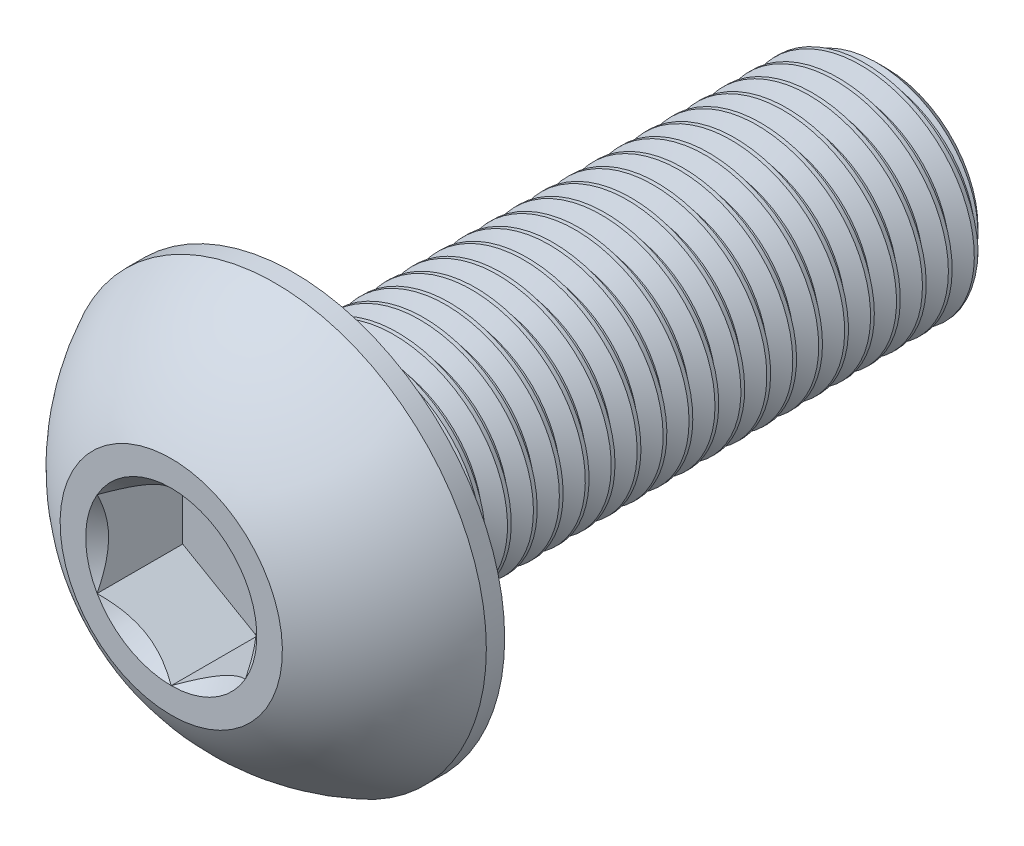
from build123d import *

# Parameters (mm, degrees)
SKETCH1_W          = 8
SKETCH1_H          = 1.5
CHAMFER1_SIZE      = 0.2625
CUT_SWEEP1_PITCH   = 0.35
CUT_EXTRUDE2_DEPTH = 1.155


with BuildPart() as part:
    # Sketch1 → Revolve1 (revolve)
    with BuildSketch(Plane(origin=(0, 0, 0), x_dir=(0, 0, -1), z_dir=(1, 0, 0))):
        with Locations((5.65, 0.75)):
            Rectangle(SKETCH1_W, SKETCH1_H)
    revolve(axis=Axis((0, 0, -9.65), (0, 0, 1)))

    # Chamfer1
    chamfer1_edges = [part.edges().sort_by_distance(p)[0] for p in [
        (0, -1.5, -9.65),
    ]]
    chamfer(chamfer1_edges, length=CHAMFER1_SIZE)

    # Cut-Sweep1: the profile of Sketch2 profile screwed along a right-hand helix of 23.857143 turns, 6 arcs to a turn; built about Z, then put on its axis
    cut_sweep1_z = Axis((0, 0, 0), (0, 0, 1))
    cut_sweep1_corners = [(1.5003, 0, 0.000173205), (1.5003, 0, -0.299423205), (1.284792687, 0, -0.175), (1.284792687, 0, -0.12425)]
    with BuildLine(mode=Mode.PRIVATE) as cut_sweep1_profile:
        Line(cut_sweep1_corners[0], cut_sweep1_corners[1])
        Line(cut_sweep1_corners[1], cut_sweep1_corners[2])
        Line(cut_sweep1_corners[2], cut_sweep1_corners[3])
        Line(cut_sweep1_corners[3], cut_sweep1_corners[0])
    cut_sweep1_cap = Face(cut_sweep1_profile.wire())
    cut_sweep1_turn_angles = [0, 30, 60, 90, 120, 150, 180, 210, 240, 270, 300, 330, 360]
    cut_sweep1_turn_weights = [1, 0.8660254037844387, 1, 0.8660254037844387, 1, 0.8660254037844387, 1, 0.8660254037844387, 1, 0.8660254037844387, 1, 0.8660254037844387, 1]
    cut_sweep1_turn_rails = [Edge.make_bspline([Vector(p[0], p[1], 0).rotate(cut_sweep1_z, cut_sweep1_turn_angles[k]) / cut_sweep1_turn_weights[k] + Vector(0, 0, p[2] + CUT_SWEEP1_PITCH * cut_sweep1_turn_angles[k] / 360) for k in range(13)], [0, 0, 0, 1, 1, 2, 2, 3, 3, 4, 4, 5, 5, 6, 6, 6], 2, cut_sweep1_turn_weights) for p in cut_sweep1_corners]
    cut_sweep1_turn_sides = [Face.make_surface_from_curves(cut_sweep1_turn_rails[p[0]], cut_sweep1_turn_rails[p[1]]) for p in [(0, 1), (1, 2), (2, 3), (3, 0)]]
    cut_sweep1_last_angles = [8280, 8310, 8340, 8370, 8400, 8430, 8460, 8490, 8520, 8550, 8580, 8584.285714286, 8588.571428571]
    cut_sweep1_last_weights = [1, 0.8660254037844387, 1, 0.8660254037844387, 1, 0.8660254037844387, 1, 0.8660254037844387, 1, 0.8660254037844387, 1, 0.9972037971811879, 1]
    cut_sweep1_last_rails = [Edge.make_bspline([Vector(p[0], p[1], 0).rotate(cut_sweep1_z, cut_sweep1_last_angles[k]) / cut_sweep1_last_weights[k] + Vector(0, 0, p[2] + CUT_SWEEP1_PITCH * cut_sweep1_last_angles[k] / 360) for k in range(13)], [0, 0, 0, 1, 1, 2, 2, 3, 3, 4, 4, 5, 5, 6, 6, 6], 2, cut_sweep1_last_weights) for p in cut_sweep1_corners]
    cut_sweep1_last_sides = [Face.make_surface_from_curves(cut_sweep1_last_rails[p[0]], cut_sweep1_last_rails[p[1]]) for p in [(0, 1), (1, 2), (2, 3), (3, 0)]]
    cut_sweep1 = Plane(origin=(0, 0, -9.65), x_dir=(0, 1, 0), z_dir=(0, 0, 1)) * Solid(Shell([*[p.moved(Location((0, 0, CUT_SWEEP1_PITCH * i))) for i in range(23) for p in cut_sweep1_turn_sides], *cut_sweep1_last_sides, cut_sweep1_cap, cut_sweep1_cap.rotate(cut_sweep1_z, 8588.571428571).moved(Location((0, 0, CUT_SWEEP1_PITCH * 8588.571428571 / 360)))]))
    add(cut_sweep1, mode=Mode.SUBTRACT)

    # Sketch7 → Revolve2 (revolve)
    with BuildSketch(Plane(origin=(0, 0, 0), x_dir=(0, 0, -1), z_dir=(1, 0, 0)), mode=Mode.PRIVATE) as revolve2_sk:
        with BuildLine():
            Line((1.4025, 2.85), (1.65, 2.85))
            Line((1.65, 2.85), (1.65, 0))
            Line((1.65, 0), (0, 0))
            Line((0, 0), (0, 1.5))
            ThreePointArc((0, 1.5), (0.59512511, 2.285251969), (1.4025, 2.85))
        make_face()
    revolve(revolve2_sk.sketch.rotate(Axis((0, 0, 0), (0, 0, -1)), 183.849419106), axis=Axis((0, 0, 0), (0, 0, -1)))

    # Sketch5 → Cut-Extrude2 (cut)
    with BuildSketch(Plane.XY):
        Polygon((1, -0.577350269), (1, 0.577350269), (0, 1.154700538), (-1, 0.577350269), (-1, -0.577350269), (0, -1.154700538), align=None)
    extrude(amount=-CUT_EXTRUDE2_DEPTH, mode=Mode.SUBTRACT)

    # Cut-Extrude3 cone 1 section (through the dimple's axis) → Cut-Extrude3 (revolve, cut)
    with BuildSketch(Plane(origin=(0, 0, 0), x_dir=(0, -1, 0), z_dir=(1, 0, 0))):
        Polygon((0, 0), (1.154700538, 0), (0, 1.154700538), align=None)
    revolve(axis=Axis((0, 0, 0), (0, 0, -1)), mode=Mode.SUBTRACT)


solid = part.part
